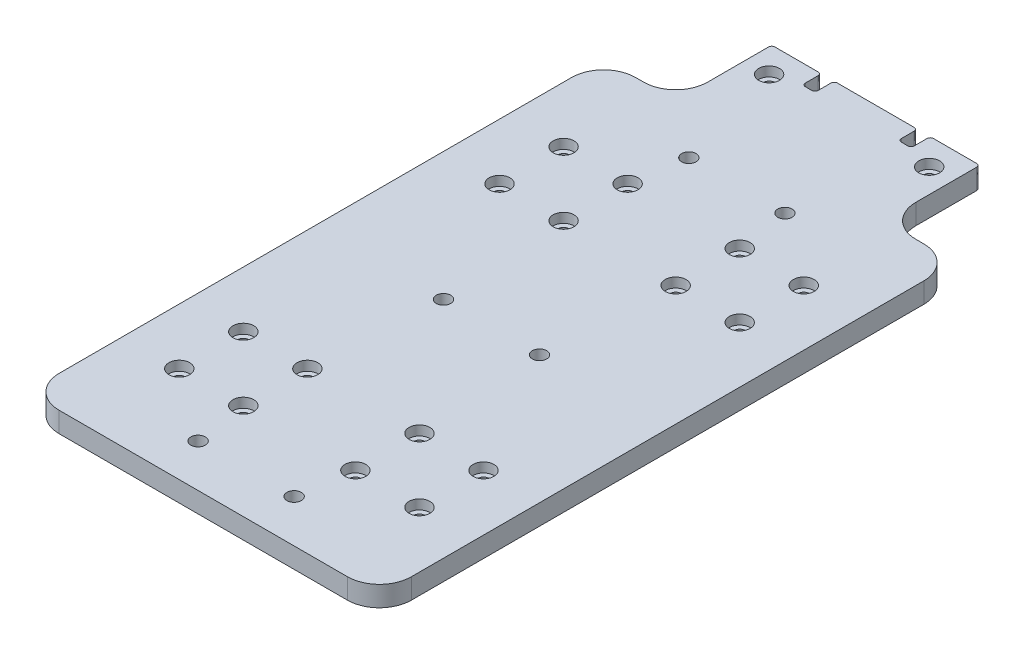
from build123d import *

# Parameters (mm, degrees)
SKETCH1_W                      = 110
SKETCH1_H                      = 180
BOSS_EXTRUDE1_DEPTH            = 6.35
CBORE_START                    = 3.35
CBORE_FOR_M3_SHCS2_OUTLINE_R   = 3.25
CBORE_FOR_M3_SHCS2_DEPTH       = 3
CBORE_FOR_M3_SHCS2_2_OUTLINE_R = 1.7
CBORE_FOR_M3_SHCS2_2_DEPTH     = 3.35
M4_CLEARANCE_HOLE1_D           = 4.5
SKETCH6_W                      = 65
SKETCH6_H                      = 6.35
BOSS_EXTRUDE2_DEPTH            = 30
CBORE_FOR_M3_SHCS1_D           = 3.4
CBORE_FOR_M3_SHCS1_CBORE_D     = 6.5
CBORE_FOR_M3_SHCS1_CBORE_DEPTH = 3
FILLET2_R                      = 10
FILLET3_R                      = 10
SKETCH9_W                      = 4
SKETCH9_H                      = 6
CUT_EXTRUDE1_DEPTH             = 212.045782948
FILLET4_R                      = 1
FILLET5_R                      = 1
FILLET6_R                      = 1


# Read off the part's stored shape, not the designer's step: CBORE for M3 SHCS2
with BuildPart() as part:
    # Sketch1 → Boss-Extrude1 (new body)
    with BuildSketch(Plane(origin=(0, 0, 0), x_dir=(1, 0, 0), z_dir=(0, 1, 0))):
        with Locations((55, -90)):
            Rectangle(SKETCH1_W, SKETCH1_H)
    extrude(amount=BOSS_EXTRUDE1_DEPTH)

    # CBORE for M3 SHCS2 outline → CBORE for M3 SHCS2 (cut)
    with BuildSketch(Plane(origin=(0, 0, 0), x_dir=(1, 0, 0), z_dir=(0, 1, 0)).offset(CBORE_START)):
        with Locations((37.5, -150)):
            Circle(CBORE_FOR_M3_SHCS2_OUTLINE_R)
        with Locations((37.5, -130)):
            Circle(CBORE_FOR_M3_SHCS2_OUTLINE_R)
        with Locations((17.5, -130)):
            Circle(CBORE_FOR_M3_SHCS2_OUTLINE_R)
        with Locations((72.5, -150)):
            Circle(CBORE_FOR_M3_SHCS2_OUTLINE_R)
        with Locations((72.5, -130)):
            Circle(CBORE_FOR_M3_SHCS2_OUTLINE_R)
        with Locations((92.5, -130)):
            Circle(CBORE_FOR_M3_SHCS2_OUTLINE_R)
        with Locations((72.5, -30)):
            Circle(CBORE_FOR_M3_SHCS2_OUTLINE_R)
        with Locations((92.5, -50)):
            Circle(CBORE_FOR_M3_SHCS2_OUTLINE_R)
        with Locations((72.5, -50)):
            Circle(CBORE_FOR_M3_SHCS2_OUTLINE_R)
        with Locations((37.5, -30)):
            Circle(CBORE_FOR_M3_SHCS2_OUTLINE_R)
        with Locations((17.5, -50)):
            Circle(CBORE_FOR_M3_SHCS2_OUTLINE_R)
        with Locations((37.5, -50)):
            Circle(CBORE_FOR_M3_SHCS2_OUTLINE_R)
        with Locations((92.5, -150)):
            Circle(CBORE_FOR_M3_SHCS2_OUTLINE_R)
        with Locations((17.5, -30)):
            Circle(CBORE_FOR_M3_SHCS2_OUTLINE_R)
        with Locations((17.5, -150)):
            Circle(CBORE_FOR_M3_SHCS2_OUTLINE_R)
        with Locations((92.5, -30)):
            Circle(CBORE_FOR_M3_SHCS2_OUTLINE_R)
    extrude(amount=CBORE_FOR_M3_SHCS2_DEPTH, mode=Mode.SUBTRACT)

    # CBORE for M3 SHCS2 2 outline → CBORE for M3 SHCS2 2 (cut)
    with BuildSketch(Plane(origin=(0, 0, 0), x_dir=(1, 0, 0), z_dir=(0, 1, 0))):
        with Locations((37.5, -150)):
            Circle(CBORE_FOR_M3_SHCS2_2_OUTLINE_R)
        with Locations((37.5, -130)):
            Circle(CBORE_FOR_M3_SHCS2_2_OUTLINE_R)
        with Locations((17.5, -130)):
            Circle(CBORE_FOR_M3_SHCS2_2_OUTLINE_R)
        with Locations((72.5, -150)):
            Circle(CBORE_FOR_M3_SHCS2_2_OUTLINE_R)
        with Locations((72.5, -130)):
            Circle(CBORE_FOR_M3_SHCS2_2_OUTLINE_R)
        with Locations((92.5, -130)):
            Circle(CBORE_FOR_M3_SHCS2_2_OUTLINE_R)
        with Locations((72.5, -30)):
            Circle(CBORE_FOR_M3_SHCS2_2_OUTLINE_R)
        with Locations((92.5, -50)):
            Circle(CBORE_FOR_M3_SHCS2_2_OUTLINE_R)
        with Locations((72.5, -50)):
            Circle(CBORE_FOR_M3_SHCS2_2_OUTLINE_R)
        with Locations((37.5, -30)):
            Circle(CBORE_FOR_M3_SHCS2_2_OUTLINE_R)
        with Locations((17.5, -50)):
            Circle(CBORE_FOR_M3_SHCS2_2_OUTLINE_R)
        with Locations((37.5, -50)):
            Circle(CBORE_FOR_M3_SHCS2_2_OUTLINE_R)
        with Locations((92.5, -150)):
            Circle(CBORE_FOR_M3_SHCS2_2_OUTLINE_R)
        with Locations((17.5, -30)):
            Circle(CBORE_FOR_M3_SHCS2_2_OUTLINE_R)
        with Locations((17.5, -150)):
            Circle(CBORE_FOR_M3_SHCS2_2_OUTLINE_R)
        with Locations((92.5, -30)):
            Circle(CBORE_FOR_M3_SHCS2_2_OUTLINE_R)
    extrude(amount=CBORE_FOR_M3_SHCS2_2_DEPTH, mode=Mode.SUBTRACT)

    # M4 Clearance Hole1 (through all)
    with Locations(Plane.XZ):
        with Locations((70, 13.375), (70, 166.625), (40, 166.625), (70, 90), (40, 90), (40, 13.375)):
            Hole(M4_CLEARANCE_HOLE1_D / 2)

    # Sketch6 → Boss-Extrude2 (add)
    with BuildSketch(Plane(origin=(0, 0, 0), x_dir=(-1, 0, 0), z_dir=(0, 0, -1))):
        with Locations((-55, 3.175)):
            Rectangle(SKETCH6_W, SKETCH6_H)
    extrude(amount=BOSS_EXTRUDE2_DEPTH)

    # CBORE for M3 SHCS1 (through all)
    with Locations(Plane(origin=(0, 6.35, 0), x_dir=(1, 0, 0), z_dir=(0, 1, 0))):
        with Locations((30, 21.675), (80, 21.675)):
            CounterBoreHole(CBORE_FOR_M3_SHCS1_D / 2, CBORE_FOR_M3_SHCS1_CBORE_D / 2, CBORE_FOR_M3_SHCS1_CBORE_DEPTH)

    # Fillet2
    fillet2_edges = [part.edges().sort_by_distance(p)[0] for p in [
        (87.5, 3.175, 0),
        (22.5, 3.175, 0),
    ]]
    fillet(fillet2_edges, radius=FILLET2_R)

    # Fillet3
    fillet3_edges = [part.edges().sort_by_distance(p)[0] for p in [
        (0, 3.175, 0),
        (110, 3.175, 0),
        (110, 3.175, 180),
        (0, 3.175, 180),
    ]]
    fillet(fillet3_edges, radius=FILLET3_R)

    # Sketch9 → Cut-Extrude1 (cut, through all)
    with BuildSketch(Plane(origin=(0, 6.35, 0), x_dir=(1, 0, 0), z_dir=(0, 1, 0))):
        with Locations((70, 27)):
            Rectangle(SKETCH9_W, SKETCH9_H)
        with Locations((40, 27)):
            Rectangle(SKETCH9_W, SKETCH9_H)
    extrude(amount=-CUT_EXTRUDE1_DEPTH, mode=Mode.SUBTRACT)

    # Fillet4
    fillet4_edges = [part.edges().sort_by_distance(p)[0] for p in [
        (38, 3.175, -24),
        (42, 3.175, -24),
        (72, 3.175, -24),
        (68, 3.175, -24),
    ]]
    fillet(fillet4_edges, radius=FILLET4_R)

    # Fillet5
    fillet5_edges = [part.edges().sort_by_distance(p)[0] for p in [
        (38, 3.175, -30),
        (42, 3.175, -30),
        (72, 3.175, -30),
        (68, 3.175, -30),
    ]]
    fillet(fillet5_edges, radius=FILLET5_R)

    # Fillet6
    fillet6_edges = [part.edges().sort_by_distance(p)[0] for p in [
        (87.5, 3.175, -30),
        (22.5, 3.175, -30),
    ]]
    fillet(fillet6_edges, radius=FILLET6_R)


solid = part.part
